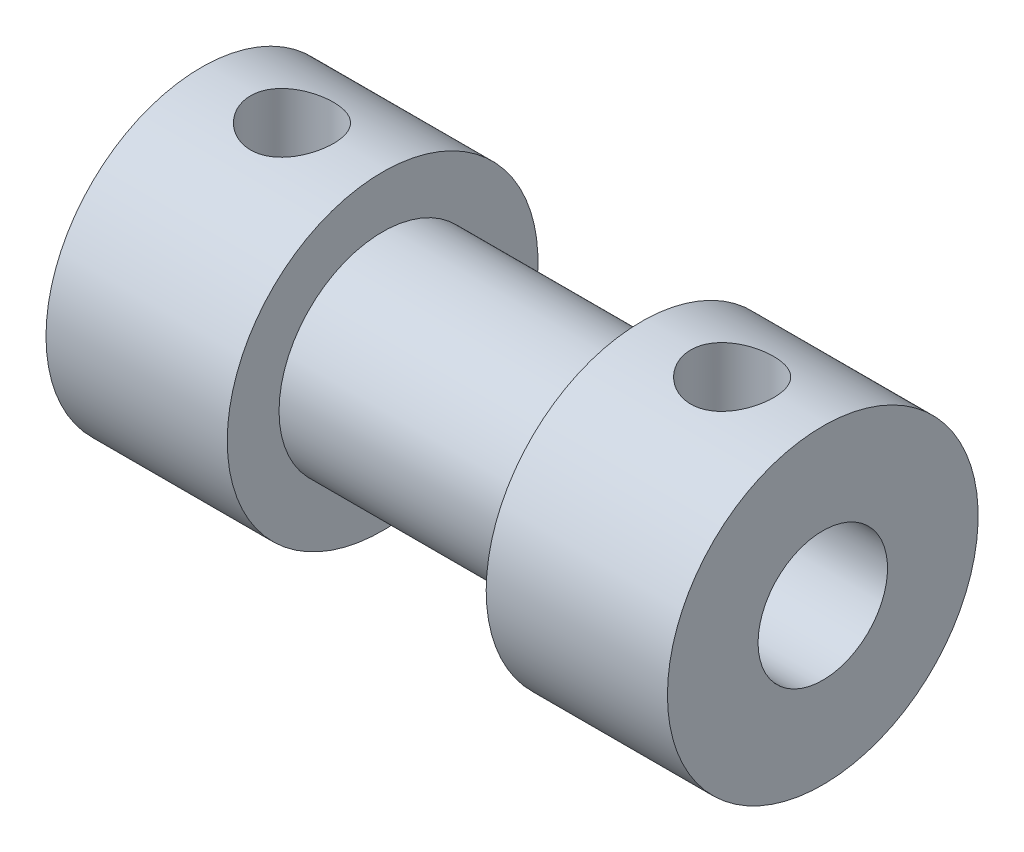
from build123d import *

# Parameters (mm, degrees)
SKETCH2_R          = 1.6
CUT_EXTRUDE1_DEPTH = 10


with BuildPart() as part:
    # Sketch1 → Revolve1 (revolve)
    with BuildSketch(Plane.XY):
        Polygon((0, -2.5), (0, -6), (7, -6), (7, -4), (17, -4), (17, -6), (24, -6), (24, -2.5), align=None)
    revolve(axis=Axis((0, 0, 0), (1, 0, 0)))

    # Sketch2 → Cut-Extrude1 (cut)
    with BuildSketch(Plane(origin=(0, 0, 0), x_dir=(1, 0, 0), z_dir=(0, 1, 0))):
        with Locations((3.5, 0)):
            Circle(SKETCH2_R)
        with Locations((20.5, 0)):
            Circle(SKETCH2_R)
    extrude(amount=CUT_EXTRUDE1_DEPTH, mode=Mode.SUBTRACT)


solid = part.part
